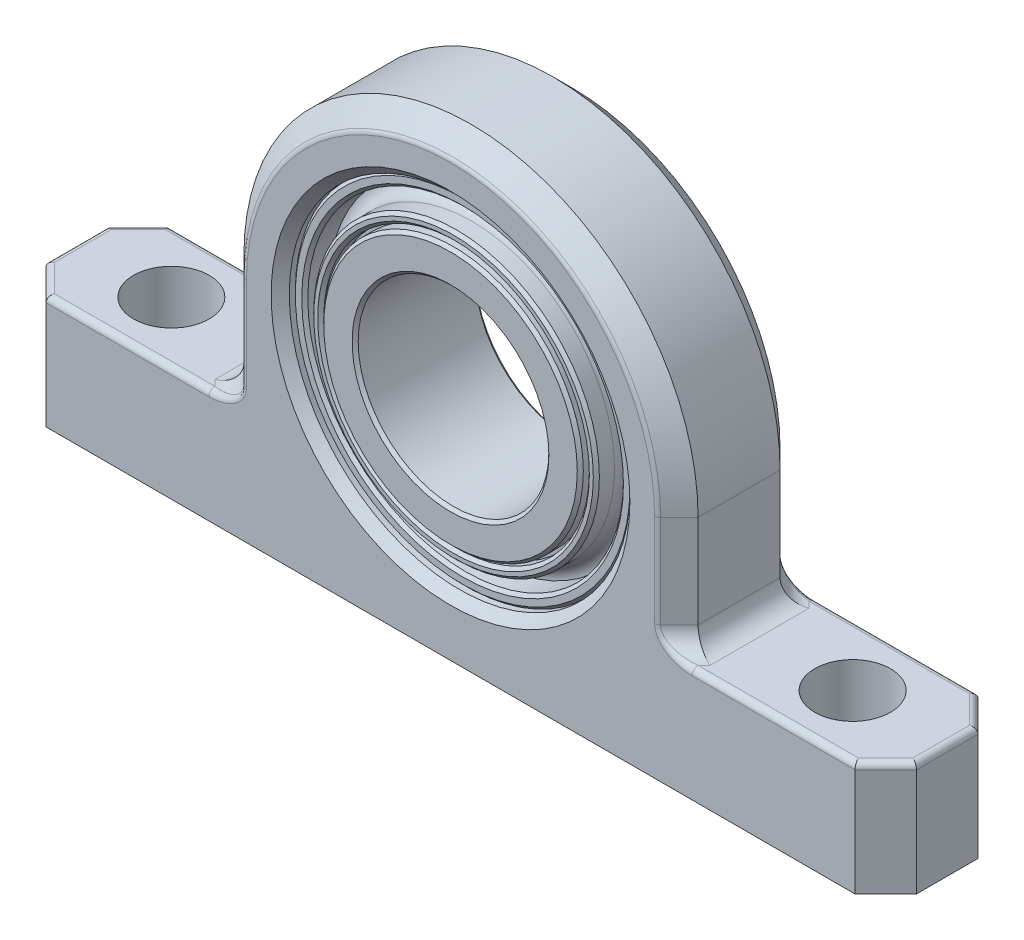
from build123d import *

# Parameters (mm, degrees)
EXTRUDE1_DEPTH      = 2.579687
EXTRUDE1_DEPTH_BACK = 2.579687
SKETCH3_R           = 7.14375
SKETCH4_R           = 1.5875
CUT_EXTRUDE1_DEPTH  = 24.325481888
CHAMFER3_SIZE       = 0.859895833
FILLET6_R           = 0.859895833
FILLET7_R           = 0.254
CHAMFER4_SIZE       = 0.381
CHAMFER5_SIZE       = 0.127
FILLET8_R           = 0.635


with BuildPart() as part:
    # Sketch3 → Extrude1 (new, two sides: drawn at the far end of the back side and taken through both)
    with BuildSketch(Plane.XY.offset(-EXTRUDE1_DEPTH_BACK)):
        with BuildLine():
            Line((9.525, 0), (9.525, -4.7625))
            Line((9.525, -4.7625), (18.25625, -4.7625))
            Line((18.25625, -4.7625), (18.25625, -9.525))
            Line((18.25625, -9.525), (-18.25625, -9.525))
            Line((-18.25625, -9.525), (-18.25625, -4.7625))
            Line((-18.25625, -4.7625), (-9.525, -4.7625))
            Line((-9.525, -4.7625), (-9.525, 0))
            ThreePointArc((-9.525, 0), (0, 9.525), (9.525, 0))
        make_face()
        Circle(SKETCH3_R, mode=Mode.SUBTRACT)
    extrude(amount=EXTRUDE1_DEPTH + EXTRUDE1_DEPTH_BACK)

    # Sketch4 → Cut-Extrude1 (cut, through all)
    with BuildSketch(Plane(origin=(0, -4.7625, 0), x_dir=(1, 0, 0), z_dir=(0, 1, 0))):
        with Locations(Location((-14.2875, 0, 0), (0, 0, 270))):
            Circle(SKETCH4_R)
        with Locations(Location((14.2875, 0, 0), (0, 0, 270))):
            Circle(SKETCH4_R)
        Polygon((-18.25625, 2.5796875), (-18.25625, 1.28984375), (-16.96640625, 2.5796875), align=None)
        Polygon((16.96640625, 2.5796875), (18.25625, 2.5796875), (18.25625, 1.28984375), align=None)
        Polygon((18.25625, -2.5796875), (18.25625, -1.28984375), (16.96640625, -2.5796875), align=None)
        Polygon((-16.96640625, -2.5796875), (-18.25625, -2.5796875), (-18.25625, -1.28984375), align=None)
    extrude(amount=-CUT_EXTRUDE1_DEPTH, mode=Mode.SUBTRACT)

    # Chamfer3
    chamfer3_edges = [part.edges().sort_by_distance(p)[0] for p in [
        (0, 9.525, -2.579687),
        (9.525, -2.38125, -2.579687),
        (9.525, -2.38125, 2.579687),
        (-9.525, -2.38125, -2.579687),
        (0, 9.525, 2.579687),
        (-9.525, -2.38125, 2.579687),
    ]]
    chamfer(chamfer3_edges, length=CHAMFER3_SIZE)

    # Fillet6
    fillet6_edges = [part.edges().sort_by_distance(p)[0] for p in [
        (9.525, -4.7625, 0),
        (-9.095052083, -4.7625, -2.149739083),
        (9.095052083, -4.7625, -2.149739083),
        (-9.095052083, -4.7625, 2.149739083),
        (9.095052083, -4.7625, 2.149739083),
        (-9.525, -4.7625, 0),
    ]]
    fillet(fillet6_edges, radius=FILLET6_R)

    # Fillet7
    fillet7_edges = [part.edges().sort_by_distance(p)[0] for p in [
        (8.665104167, -1.951302083, -2.579687),
        (0, 8.665104167, -2.579687),
        (0, 8.665104167, 2.579687),
        (-8.665104167, -1.951302083, 2.579687),
        (-13.423793633, -4.7625, 2.579687),
        (-13.423793633, -4.7625, -2.579687),
        (-8.665104167, -1.951302083, -2.579687),
        (8.665104167, -1.951302083, 2.579687),
        (-9.095535719, -4.558959231, -2.579687),
        (-9.095535719, -4.558959231, 2.579687),
        (9.095535719, -4.558959231, -2.579687),
        (9.095535719, -4.558959231, 2.579687),
        (-17.611328375, -4.7625, -1.934765375),
        (13.423793633, -4.7625, -2.579687),
        (17.611328375, -4.7625, -1.934765375),
        (18.25625, -4.7625, 0),
        (13.423793633, -4.7625, 2.579687),
        (17.611328375, -4.7625, 1.934765375),
        (-18.25625, -4.7625, 0),
        (-17.611328375, -4.7625, 1.934765375),
    ]]
    fillet(fillet7_edges, radius=FILLET7_R)

    # Chamfer4
    chamfer4_edges = [part.edges().sort_by_distance(p)[0] for p in [
        (-7.14375, 0, 2.579687),
        (-7.14375, 0, -2.579687),
    ]]
    chamfer(chamfer4_edges, length=CHAMFER4_SIZE)


with BuildPart() as body_2:
    # Sketch5 → Revolve1 (revolve)
    with BuildSketch(Plane(origin=(0, 0, 0), x_dir=(0, 0, -1), z_dir=(1, 0, 0)), mode=Mode.PRIVATE) as revolve1_sk:
        Polygon((-2.0716875, 6.619791667), (-1.0556875, 6.619791667), (-1.0556875, 5.991041667), (-2.4526875, 5.991041667), (-2.4526875, 5.571875), (-1.9446875, 5.571875), (-1.9446875, 5.444875), (-2.5796875, 5.444875), (-2.5796875, 4), (2.5796875, 4), (2.5796875, 5.444875), (1.9446875, 5.444875), (1.9446875, 5.571875), (2.4526875, 5.571875), (2.4526875, 5.991041667), (1.0556875, 5.991041667), (1.0556875, 6.619791667), (2.0716875, 6.619791667), (2.0716875, 7.14375), (-2.0716875, 7.14375), align=None)
    revolve(revolve1_sk.sketch.rotate(Axis((0, 0, -2.5796875), (0, 0, 1)), 90), axis=Axis((0, 0, -2.5796875), (0, 0, 1)))

    # Chamfer5
    chamfer5_edges = [body_2.edges().sort_by_distance(p)[0] for p in [
        (5.991041667, 0, 2.4526875),
        (5.571875, 0, 2.4526875),
        (5.444875, 0, 2.5796875),
        (4, 0, 2.5796875),
        (4, 0, -2.5796875),
        (5.444875, 0, -2.5796875),
        (5.571875, 0, -2.4526875),
        (5.991041667, 0, -2.4526875),
        (6.619791667, 0, -2.0716875),
        (7.14375, 0, -2.0716875),
        (7.14375, 0, 2.0716875),
        (6.619791667, 0, 2.0716875),
    ]]
    chamfer(chamfer5_edges, length=CHAMFER5_SIZE)

    # Fillet8
    # the kernel refuses this fillet: 0.635 mm, written as the material it adds along each edge
    with BuildSketch(Plane(origin=(0, 0, 1.0556875), x_dir=(-1, 0, 0), z_dir=(0, 1, 0))) as fillet8_piece_1:
        with BuildLine():
            CenterArc((5.991041667 + FILLET8_R, FILLET8_R), FILLET8_R, 180, 90)
            Line((5.991041667, FILLET8_R), (5.991041667, 0))
            Line((5.991041667, 0), (5.991041667 + FILLET8_R, 0))
        make_face()
    revolve(axis=Axis((0, 0, 1.0556875), (0, 0, 1)))
    with BuildSketch(Plane(origin=(0, 0, -1.0556875), x_dir=(-1, 0, 0), z_dir=(0, 1, 0))) as fillet8_piece_2:
        with BuildLine():
            CenterArc((5.991041667 + FILLET8_R, -FILLET8_R), FILLET8_R, 90, 90)
            Line((5.991041667, -FILLET8_R), (5.991041667, 0))
            Line((5.991041667, 0), (5.991041667 + FILLET8_R, 0))
        make_face()
    revolve(axis=Axis((0, 0, -1.0556875), (0, 0, 1)))


solid = Compound([part.part, body_2.part])
